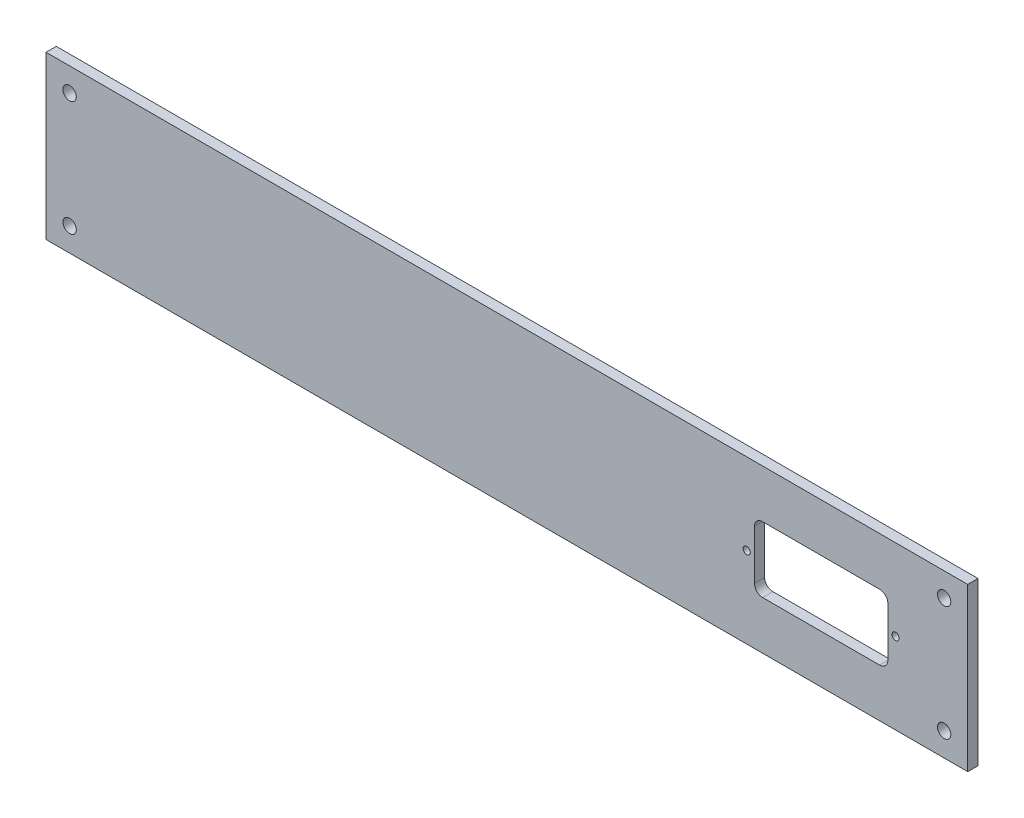
from build123d import *

# Parameters (mm, degrees)
SKETCH_F_W                   = 449
SKETCH_F_H                   = 79
SKETCH_F_R                   = 3.25
ESTRUSIONE_ESTRUSIONE1_DEPTH = 5
SKETCH1_R                    = 1.75
EXTRUDE1_DEPTH               = 456.924335828


with BuildPart() as part:
    # Sketch f → Estrusione-Estrusione1 (new body)
    with BuildSketch(Plane.XY):
        with Locations((224.5, 39.5)):
            Rectangle(SKETCH_F_W, SKETCH_F_H)
        with Locations((11.5, 67.5)):
            Circle(SKETCH_F_R, mode=Mode.SUBTRACT)
        with Locations((437.5, 67.5)):
            Circle(SKETCH_F_R, mode=Mode.SUBTRACT)
        with Locations((11.5, 11.5)):
            Circle(SKETCH_F_R, mode=Mode.SUBTRACT)
        with Locations((437.5, 11.5)):
            Circle(SKETCH_F_R, mode=Mode.SUBTRACT)
    extrude(amount=ESTRUSIONE_ESTRUSIONE1_DEPTH)

    # Sketch1 → Extrude1 (cut, through all)
    with BuildSketch(Plane(origin=(0, 0, 0), x_dir=(-1, 0, 0), z_dir=(0, 0, -1))):
        with Locations((-341.3246338, 39.505506417)):
            Circle(SKETCH1_R)
        with Locations((-413.8246338, 39.505506417)):
            Circle(SKETCH1_R)
        with BuildLine():
            Line((-349.0746338, 55.5), (-406.0746338, 55.5))
            ThreePointArc((-406.0746338, 55.5), (-408.903060925, 54.328427125), (-410.0746338, 51.5))
            Line((-410.0746338, 51.5), (-410.0746338, 27.5))
            ThreePointArc((-410.0746338, 27.5), (-408.903060925, 24.671572875), (-406.0746338, 23.5))
            Line((-406.0746338, 23.5), (-349.0746338, 23.5))
            ThreePointArc((-349.0746338, 23.5), (-346.246206675, 24.671572875), (-345.0746338, 27.5))
            Line((-345.0746338, 27.5), (-345.0746338, 51.5))
            ThreePointArc((-345.0746338, 51.5), (-346.246206675, 54.328427125), (-349.0746338, 55.5))
        make_face()
    extrude(amount=-EXTRUDE1_DEPTH, mode=Mode.SUBTRACT)


solid = part.part
